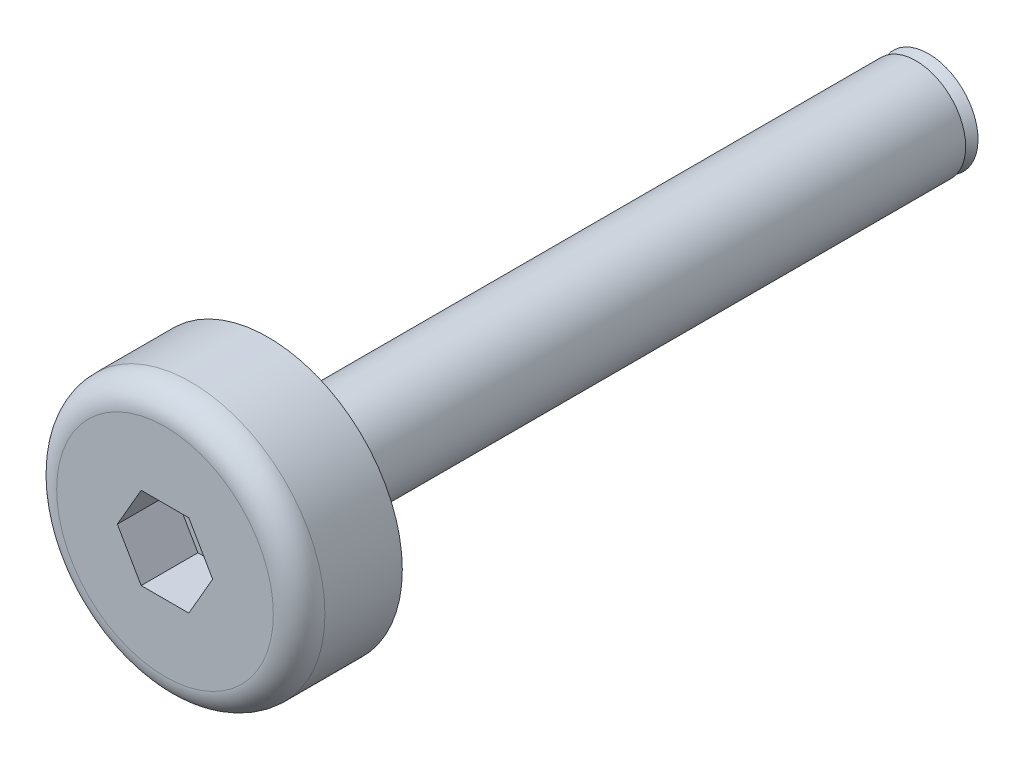
from build123d import *

# Parameters (mm, degrees)
F_0060_CYLINDER_SKETCH_R    = 3.25
F_0060_CYLINDER_DEPTH       = 2.5
F_0061_FILLET_R             = 0.625
F_0062_EXTRUDE_DEPTH        = 1.385
F_0062_EXTRUDE_ROTATE_ANGLE = 120
F_0065_CYLINDER_SKETCH_R    = 1.2
F_0065_CYLINDER_DEPTH       = 15.7
F_0066_CONE_ROTATE_ANGLE    = 90


with BuildPart() as part:
    # 0060_cylinder_Sketch → 0060_cylinder (new body)
    with BuildSketch(Plane.XY):
        Circle(F_0060_CYLINDER_SKETCH_R)
    extrude(amount=F_0060_CYLINDER_DEPTH)

    # 0061_fillet
    f_0061_fillet_edges = [part.edges().sort_by_distance(p)[0] for p in [
        (-3.25, 0, 2.5),
    ]]
    fillet(f_0061_fillet_edges, radius=F_0061_FILLET_R)


with BuildPart() as body_2:
    # 0062_extrude_Sketch → 0062_extrude (new body)
    with BuildSketch(Plane.XY):
        Polygon((0, 0), (1.154700538, 0), (1.732050808, 1), (1.154700538, 2), (0, 2), (-0.577350269, 1), align=None)
    extrude(amount=F_0062_EXTRUDE_DEPTH)


with BuildPart() as body_2_1:
    # 0062_extrude_Rotate: read off the stored shape, not the designer's step
    # 0062_extrude_Rotate: moved
    add(body_2.part.rotate(Axis((0, 0, 0), (0, 0, 1)), F_0062_EXTRUDE_ROTATE_ANGLE))


with BuildPart() as body_2_2:
    # 0062_extrude_Translate: moved
    add(body_2_1.part.moved(Location((1.154700538, 0, 1.125))))


with BuildPart() as part_1:
    add(part.part)

    # 0064_sub: cut body 2
    add(body_2_2.part, mode=Mode.SUBTRACT)


with BuildPart() as body_2_2_1:
    # 0065_cylinder_Sketch → 0065_cylinder (new body)
    with BuildSketch(Plane.XY):
        Circle(F_0065_CYLINDER_SKETCH_R)
    extrude(amount=F_0065_CYLINDER_DEPTH)


with BuildPart() as body_2_2_2:
    # 0065_cylinder_Translate: moved
    add(body_2_2_1.part.moved(Location((0, 0, -15.7))))


with BuildPart() as body_3:
    # 0066_cone_Sketch → 0066_cone (revolve)
    with BuildSketch(Plane.XY, mode=Mode.PRIVATE) as f_0066_cone_sk:
        Polygon((0, 0), (1.2, 0), (0.9, 0.3), (0, 0.3), align=None)
    revolve(f_0066_cone_sk.sketch.rotate(Axis((0, -100, 0), (0, 1, 0)), 90), axis=Axis((0, -100, 0), (0, 1, 0)))


with BuildPart() as body_3_1:
    # 0066_cone_Rotate: moved
    add(body_3.part.rotate(Axis((0, 0, 0), (1, 0, 0)), F_0066_CONE_ROTATE_ANGLE))


with BuildPart() as body_3_2:
    # 0066_cone_Translate: moved
    add(body_3_1.part.moved(Location((0, 0, -16))))


with BuildPart() as body_2_2_3:
    add(body_2_2_2.part)

    # 0068_add: union body 3
    add(body_3_2.part)


with BuildPart() as part_2:
    add(part_1.part)

    # 0069_add: union body 2 2
    add(body_2_2_3.part)


solid = part_2.part
